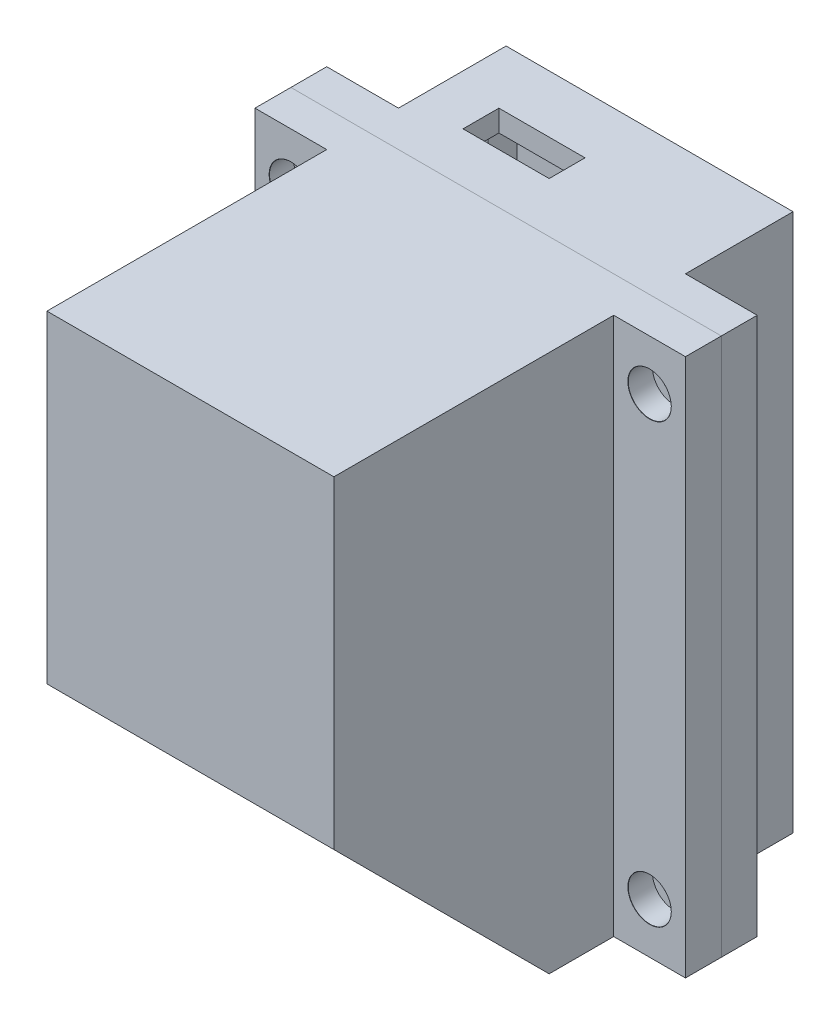
from build123d import *

# Parameters (mm, degrees)
SKETCH_1_W                     = 40
SKETCH_1_H                     = 75
EXTRUDE_1_DEPTH                = 30
SHELL_1_T                      = -3
SKETCH_2_W                     = 34
SKETCH_2_H                     = 69
EXTRUDE_2_DEPTH                = 5
SKETCH_3_W                     = 29
SKETCH_3_H                     = 58
CUT_EXTRUDE_1_DEPTH            = 4
SKETCH_4_W                     = 12
SKETCH_4_H                     = 5
CUT_EXTRUDE_2_DEPTH            = 3
SKETCH_5_W                     = 40
SKETCH_5_H                     = 75
SKETCH_5_W_2                   = 34
SKETCH_5_H_2                   = 69
EXTRUDE_5_DEPTH                = 30
CUT_EXTRUDE_START              = -40
CUT_EXTRUDE_5_DEPTH            = 40
SKETCH_8_W                     = 40
SKETCH_8_H                     = 45
EXTRUDE_6_DEPTH                = 4
SWEEP_START                    = -20
SWEEP_1_DEPTH                  = 40
CUT_EXTRUDE_6_REACH            = 85.926
SKETCH_12_R                    = 2.5
CUT_EXTRUDE_7_REACH            = 85.926
SKETCH_14_W                    = 5
SKETCH_14_H                    = 3
SKETCH_22_W                    = 10
SKETCH_22_H                    = 75
EXTRUDE_8_DEPTH                = 5
CUT_EXTRUDE_9_DEPTH            = 2
MIRROR_6_COPY_2_DEPTH          = 2
SPLIT_BODIES_2_SURFACE_1_BACK  = 116.417
SPLIT_BODIES_2_SURFACE_1_DEPTH = 232.834
SPLIT_BODIES_2_SURFACE_2_BACK  = 116.417
SPLIT_BODIES_2_SURFACE_2_DEPTH = 232.834
CUT_EXTRUDE_10_DEPTH           = 1


# Read off the part's stored shape, not the designer's step: 切除-拉伸5, 扫描1
with BuildPart() as part:
    # 草图1 → 凸台-拉伸1 (new body)
    with BuildSketch(Plane.XY):
        Rectangle(SKETCH_1_W, SKETCH_1_H)
    extrude(amount=EXTRUDE_1_DEPTH)

    # 抽壳1
    shell_1_openings = [part.faces().sort_by_distance(p)[0] for p in [
        (0, 0, 30),
    ]]
    offset(amount=SHELL_1_T, openings=shell_1_openings, kind=Kind.INTERSECTION)

    # 草图2 → 凸台-拉伸2 (add)
    with BuildSketch(Plane.XY.offset(3)):
        Rectangle(SKETCH_2_W, SKETCH_2_H)
    extrude(amount=EXTRUDE_2_DEPTH)

    # 草图3 → 切除-拉伸1 (cut)
    with BuildSketch(Plane.XY.offset(8)):
        with Locations((0, 5.5)):
            Rectangle(SKETCH_3_W, SKETCH_3_H)
    extrude(amount=-CUT_EXTRUDE_1_DEPTH, mode=Mode.SUBTRACT)

    # 草图4 → 切除-拉伸2 (cut)
    with BuildSketch(Plane(origin=(0, 37.5, 0), x_dir=(1, 0, 0), z_dir=(0, 1, 0))):
        with Locations((-7, -10.5)):
            Rectangle(SKETCH_4_W, SKETCH_4_H)
    extrude(amount=-CUT_EXTRUDE_2_DEPTH, mode=Mode.SUBTRACT)

    # 草图5 → 凸台-拉伸5 (add)
    with BuildSketch(Plane.XY.offset(30)):
        Rectangle(SKETCH_5_W, SKETCH_5_H)
        Rectangle(SKETCH_5_W_2, SKETCH_5_H_2, mode=Mode.SUBTRACT)
    extrude(amount=EXTRUDE_5_DEPTH)

    # 切除-拉伸5 outline → 切除-拉伸5 (cut)
    with BuildSketch(Plane.ZY.offset(20).offset(CUT_EXTRUDE_START)):
        Polygon((60, -7.5), (30, -37.5), (60, -37.5), align=None)
    extrude(amount=CUT_EXTRUDE_5_DEPTH, mode=Mode.SUBTRACT)

    # 草图8 → 凸台-拉伸6 (add)
    with BuildSketch(Plane.XY.offset(60)):
        with Locations((0, 15)):
            Rectangle(SKETCH_8_W, SKETCH_8_H)
    extrude(amount=EXTRUDE_6_DEPTH)

    # 扫描1 outline → 扫描1 (add)
    with BuildSketch(Plane.YZ.offset(SWEEP_START)):
        Polygon((-37.5, 34), (-37.5, 30), (-7.5, 60), (-7.5, 64), align=None)
    extrude(amount=SWEEP_1_DEPTH)

    # 草图12 → 切除-拉伸6 (cut, up to next)
    with BuildSketch(Plane(origin=(0, -35.75, 35.75), x_dir=(1, 0, 0), z_dir=(0, -0.7071067811865487, 0.7071067811865465)), mode=Mode.PRIVATE) as cut_extrude_6_sk1:
        with Locations(Location((-11, 19.162131789, 0), (0, 0, 270))):
            Circle(SKETCH_12_R)
    cut_extrude_6_tool1 = extrude(cut_extrude_6_sk1.sketch, amount=-CUT_EXTRUDE_6_REACH, mode=Mode.PRIVATE) & part.part
    cut_extrude_6 = cut_extrude_6_tool1.solids().sort_by_distance((-11, -22.200327, 49.299673))[0]
    add(cut_extrude_6, mode=Mode.SUBTRACT)

    # 镜向1: 切除-拉伸6 across plane
    add(cut_extrude_6.mirror(Plane(origin=(0, 0, 0), x_dir=(0, 0, 1), z_dir=(1, 0, 0))), mode=Mode.SUBTRACT)

    # 草图14 → 切除-拉伸7 (cut, up to next)
    with BuildSketch(Plane(origin=(0, -35.75, 35.75), x_dir=(1, 0, 0), z_dir=(0, -0.7071067811865487, 0.7071067811865465)), mode=Mode.PRIVATE) as cut_extrude_7_sk1:
        with Locations((0, 18.162131789)):
            Rectangle(SKETCH_14_W, SKETCH_14_H)
    cut_extrude_7_tool1 = extrude(cut_extrude_7_sk1.sketch, amount=-CUT_EXTRUDE_7_REACH, mode=Mode.PRIVATE) & part.part
    add(cut_extrude_7_tool1.solids().sort_by_distance((0, -22.907433, 48.592567))[0], mode=Mode.SUBTRACT)

    # 草图22 → 凸台-拉伸8 (add, symmetric)
    with BuildSketch(Plane(origin=(0, 0, 20), x_dir=(-1, 0, 0), z_dir=(0, 0, -1))):
        with Locations((-25, 0)):
            Rectangle(SKETCH_22_W, SKETCH_22_H)
    extrude_8 = extrude(amount=EXTRUDE_8_DEPTH, both=True)

    # 草图24 → M3 六角圆柱头螺钉的柱形沉头孔2 (revolve, cut)
    with BuildSketch(Plane(origin=(25, 30.5, 25), x_dir=(0, -1, 0), z_dir=(1, 0, 0))):
        Polygon((0, 0), (0, 10), (1.8, 10), (1.8, 3.4), (3, 3.4), (3, 0.025), (3.025, 0), align=None)
    hole_wizard_m3_2 = revolve(axis=Axis((25, 30.5, 31.35), (0, 0, -1)), mode=Mode.SUBTRACT)

    # 草图25 → 切除-拉伸9 (cut)
    with BuildSketch(Plane(origin=(0, 0, 15), x_dir=(-1, 0, 0), z_dir=(0, 0, -1))):
        Polygon((-28.348631561, 30.5), (-26.674315781, 27.6), (-23.325684219, 27.6), (-21.651368439, 30.5), (-23.325684219, 33.4), (-26.674315781, 33.4), align=None)
    cut_extrude_9 = extrude(amount=-CUT_EXTRUDE_9_DEPTH, mode=Mode.SUBTRACT)

    # 镜向4: M3 六角圆柱头螺钉的柱形沉头孔2, 切除-拉伸9 across plane
    add(hole_wizard_m3_2.mirror(Plane.ZX), mode=Mode.SUBTRACT)
    add(cut_extrude_9.mirror(Plane.ZX), mode=Mode.SUBTRACT)

    # 镜向6: 凸台-拉伸8, M3 六角圆柱头螺钉的柱形沉头孔2, 切除-拉伸9 across plane
    add(extrude_8.mirror(Plane(origin=(0, 0, 0), x_dir=(0, 0, 1), z_dir=(1, 0, 0))))
    add(hole_wizard_m3_2.mirror(Plane(origin=(0, 0, 0), x_dir=(0, 0, 1), z_dir=(1, 0, 0))), mode=Mode.SUBTRACT)
    add(cut_extrude_9.mirror(Plane(origin=(0, 0, 0), x_dir=(0, 0, 1), z_dir=(1, 0, 0))), mode=Mode.SUBTRACT)

    # 镜向6 copy 1 sketch → 镜向6 copy 1 (revolve, cut)
    with BuildSketch(Plane(origin=(-25, -30.5, 25), x_dir=(0, 1, 0), z_dir=(-1, 0, 0))):
        Polygon((0, 0), (0, 10), (1.8, 10), (1.8, 3.4), (3, 3.4), (3, 0.025), (3.025, 0), align=None)
    revolve(axis=Axis((-25, -30.5, 31.35), (0, 0, -1)), mode=Mode.SUBTRACT)

    # 镜向6 copy 2 sketch → 镜向6 copy 2 (cut)
    with BuildSketch(Plane(origin=(0, 0, 15), x_dir=(1, 0, 0), z_dir=(0, 0, -1))):
        Polygon((-28.348631561, 30.5), (-26.674315781, 27.6), (-23.325684219, 27.6), (-21.651368439, 30.5), (-23.325684219, 33.4), (-26.674315781, 33.4), align=None)
    extrude(amount=-MIRROR_6_COPY_2_DEPTH, mode=Mode.SUBTRACT)


with BuildPart() as body_2:
    # Split Bodies 2: the piece behind the surface
    add(part.part)
    # Split Bodies 2 surface: a surface, the sketch's curves swept straight by 232.834 mm
    with BuildLine(Plane(origin=(30, 0, 0), x_dir=(0, 0, -1), z_dir=(1, 0, 0)).offset(-SPLIT_BODIES_2_SURFACE_1_BACK), mode=Mode.PRIVATE) as split_bodies_2_surface_1_path:
        Line((-20, 42.094632645), (-20, -46.024022385))
    split_bodies_2_surface_1 = Shell.extrude(split_bodies_2_surface_1_path.wire(), (1 * SPLIT_BODIES_2_SURFACE_1_DEPTH, 0 * SPLIT_BODIES_2_SURFACE_1_DEPTH, 0 * SPLIT_BODIES_2_SURFACE_1_DEPTH))
    split(bisect_by=split_bodies_2_surface_1, keep=Keep.BOTTOM)

    # 草图27 → 切除-拉伸10 (cut)
    with BuildSketch(Plane(origin=(0, -35.75, 35.75), x_dir=(1, 0, 0), z_dir=(0, -0.7071067811865487, 0.7071067811865465))):
        Polygon((-14.348631561, 19.162131789), (-12.674315781, 16.262131789), (-9.325684219, 16.262131789), (-7.651368439, 19.162131789), (-9.325684219, 22.062131789), (-12.674315781, 22.062131789), align=None)
    cut_extrude_10 = extrude(amount=-CUT_EXTRUDE_10_DEPTH, mode=Mode.SUBTRACT)

    # 镜向7: 切除-拉伸10 across plane
    add(cut_extrude_10.mirror(Plane(origin=(0, 0, 0), x_dir=(0, 0, 1), z_dir=(1, 0, 0))), mode=Mode.SUBTRACT)


with BuildPart() as part_1:
    add(part.part)

    # Split Bodies 2: split by a surface, the side it looks to stays
    # Split Bodies 2 surface: a surface, the sketch's curves swept straight by 232.834 mm
    with BuildLine(Plane(origin=(30, 0, 0), x_dir=(0, 0, -1), z_dir=(1, 0, 0)).offset(-SPLIT_BODIES_2_SURFACE_2_BACK), mode=Mode.PRIVATE) as split_bodies_2_surface_2_path:
        Line((-20, 42.094632645), (-20, -46.024022385))
    split_bodies_2_surface_2 = Shell.extrude(split_bodies_2_surface_2_path.wire(), (1 * SPLIT_BODIES_2_SURFACE_2_DEPTH, 0 * SPLIT_BODIES_2_SURFACE_2_DEPTH, 0 * SPLIT_BODIES_2_SURFACE_2_DEPTH))
    split(bisect_by=split_bodies_2_surface_2, keep=Keep.TOP)


solid = Compound([body_2.part, part_1.part])
